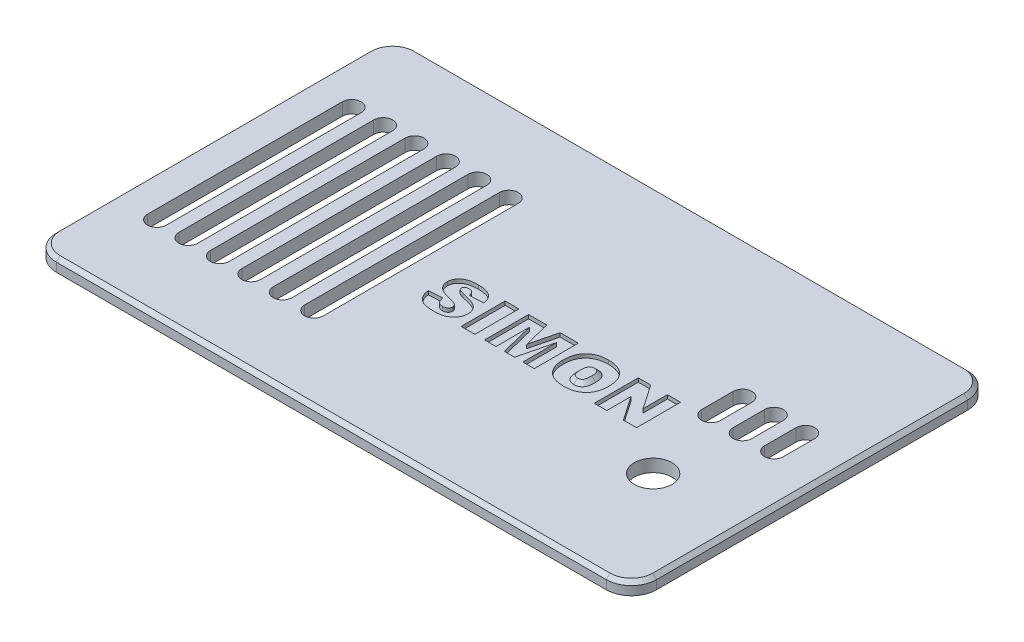
from build123d import *

# Parameters (mm, degrees)
TAPA_DEPTH                        = 2
VENTANA_LDR_Y_VENTILAS_DEPTH      = 56.77297732773462
VENTANA_LDR_Y_VENTILAS_DEPTH_BACK = 56.77297732773462
CROQUIS_VENTANA_Y_VENTILAS_R      = 3.0000000000000027
CROQUIS_TEXTO_W                   = 2.1818181818181825
CROQUIS_TEXTO_H                   = 7.000000000000001
TEXTO_SIMON_DEPTH                 = 0.6
CHAFLAN_CARA_SUPERIOR_SIZE        = 0.6


with BuildPart() as part:
    # Croquis_tapa → Tapa (new body)
    with BuildSketch(Plane(origin=(0, 0, 0), x_dir=(1, 0, 0), z_dir=(0, 1, 0))):
        with BuildLine():
            Line((-43.75000000000001, -28.75), (43.75000000000001, -28.75))
            ThreePointArc((43.75000000000001, -28.75), (46.5784271247462, -27.57842712474619), (47.75, -24.75))
            Line((47.75, -24.75), (47.75, 24.75))
            ThreePointArc((47.75, 24.75), (46.57842712474619, 27.578427124746185), (43.75000000000001, 28.75))
            Line((43.75000000000001, 28.75), (-43.75000000000001, 28.75))
            ThreePointArc((-43.75000000000001, 28.75), (-46.5784271247462, 27.57842712474619), (-47.75, 24.75))
            Line((-47.75, 24.75), (-47.75, -24.75))
            ThreePointArc((-47.75, -24.75), (-46.57842712474619, -27.578427124746185), (-43.75000000000001, -28.75))
        make_face()
    extrude(amount=TAPA_DEPTH)

    # Croquis_ventana_y_ventilas → Ventana_LDR_y_ventilas (cut, two sides: drawn at the far end of the back side and taken through both)
    with BuildSketch(Plane(origin=(0, 0, 0), x_dir=(1, 0, 0), z_dir=(0, 1, 0)).offset(-VENTANA_LDR_Y_VENTILAS_DEPTH_BACK)):
        with Locations(Location((33.46, -11, 0), (0, 0, 270))):
            Circle(CROQUIS_VENTANA_Y_VENTILAS_R)
        with BuildLine():
            Line((-17.5, -15.5), (-17.5, 15.5))
            ThreePointArc((-17.5, 15.5), (-16, 17), (-14.5, 15.5))
            Line((-14.5, 15.5), (-14.5, -15.5))
            ThreePointArc((-14.5, -15.5), (-16, -17), (-17.5, -15.5))
        make_face()
        with BuildLine():
            Line((-22.500000000000004, -15.50000000000001), (-22.500000000000004, 15.49999999999999))
            ThreePointArc((-22.500000000000004, 15.49999999999999), (-21, 16.99999999999999), (-19.5, 15.49999999999999))
            Line((-19.5, 15.49999999999999), (-19.5, -15.50000000000001))
            ThreePointArc((-19.5, -15.50000000000001), (-21, -17.000000000000014), (-22.500000000000004, -15.50000000000001))
        make_face()
        with BuildLine():
            Line((-27.500000000000004, -15.500000000000021), (-27.500000000000004, 15.499999999999979))
            ThreePointArc((-27.500000000000004, 15.499999999999979), (-26.000000000000004, 16.999999999999982), (-24.5, 15.499999999999979))
            Line((-24.5, 15.499999999999979), (-24.5, -15.500000000000021))
            ThreePointArc((-24.5, -15.500000000000021), (-26.000000000000004, -17.00000000000002), (-27.500000000000004, -15.500000000000021))
        make_face()
        with BuildLine():
            Line((-32.5, -15.500000000000032), (-32.5, 15.499999999999968))
            ThreePointArc((-32.5, 15.499999999999968), (-31, 16.999999999999968), (-29.5, 15.499999999999968))
            Line((-29.5, 15.499999999999968), (-29.5, -15.500000000000032))
            ThreePointArc((-29.5, -15.500000000000032), (-31, -17.000000000000032), (-32.5, -15.500000000000032))
        make_face()
        with BuildLine():
            Line((-37.50000000000001, -15.50000000000004), (-37.50000000000001, 15.499999999999957))
            ThreePointArc((-37.50000000000001, 15.499999999999957), (-36.00000000000001, 16.999999999999964), (-34.5, 15.499999999999957))
            Line((-34.5, 15.499999999999957), (-34.5, -15.50000000000004))
            ThreePointArc((-34.5, -15.50000000000004), (-36.00000000000001, -17.000000000000043), (-37.50000000000001, -15.50000000000004))
        make_face()
        with BuildLine():
            Line((-42.5, -15.500000000000052), (-42.5, 15.499999999999948))
            ThreePointArc((-42.5, 15.499999999999948), (-41, 16.99999999999995), (-39.5, 15.499999999999948))
            Line((-39.5, 15.499999999999948), (-39.5, -15.500000000000052))
            ThreePointArc((-39.5, -15.500000000000052), (-41, -17.00000000000005), (-42.5, -15.500000000000052))
        make_face()
        with BuildLine():
            Line((28.499999999999996, 1.68), (28.499999999999996, 6.680000000000001))
            ThreePointArc((28.499999999999996, 6.680000000000001), (30, 8.18), (31.5, 6.680000000000001))
            Line((31.5, 6.680000000000001), (31.5, 1.68))
            ThreePointArc((31.5, 1.68), (30, 0.17999999999999639), (28.499999999999996, 1.68))
        make_face()
        with BuildLine():
            Line((33.5, 1.68), (33.5, 6.680000000000001))
            ThreePointArc((33.5, 6.680000000000001), (35, 8.180000000000007), (36.50000000000001, 6.680000000000001))
            Line((36.50000000000001, 6.680000000000001), (36.50000000000001, 1.68))
            ThreePointArc((36.50000000000001, 1.68), (35, 0.17999999999999994), (33.5, 1.68))
        make_face()
        with BuildLine():
            Line((38.5, 1.68), (38.5, 6.680000000000001))
            ThreePointArc((38.5, 6.680000000000001), (40, 8.18), (41.5, 6.680000000000001))
            Line((41.5, 6.680000000000001), (41.5, 1.68))
            ThreePointArc((41.5, 1.68), (40, 0.17999999999999994), (38.5, 1.68))
        make_face()
    extrude(amount=VENTANA_LDR_Y_VENTILAS_DEPTH + VENTANA_LDR_Y_VENTILAS_DEPTH_BACK, mode=Mode.SUBTRACT)

    # Croquis_texto → Texto_SIMON (cut)
    # profile 1 of 5: a face of its own
    with BuildSketch(Plane(origin=(0, 2, 0), x_dir=(1, 0, 0), z_dir=(0, 1, 0))):
        with BuildLine():
            Line((-9.636363636363637, -3.673295454545454), (-7.454545454545455, -3.5454545454545454))
            add(Edge.make_bspline(
                [(-7.454545454545455, -3.5454545454545454), (-7.443334879168272, -3.623888172631611), (-7.422138415725998, -3.772187029306458), (-7.367963968321025, -3.978497338687695), (-7.299675120562156, -4.156745220271855), (-7.235906679516529, -4.257902176777443), (-7.205965909090909, -4.3053977272727275)],
                knots=[0, 0, 0, 0, 1.1770868639817493, 2.2255841329561408, 3.166870363402418, 3.9999999999999996, 3.9999999999999996, 3.9999999999999996, 3.9999999999999996], degree=3))
            add(Edge.make_bspline(
                [(-7.205965909090909, -4.3053977272727275), (-7.179788136074212, -4.339245246532298), (-7.128590569553015, -4.405443032637478), (-7.038959563551368, -4.491551022292443), (-6.941728468338179, -4.564655482865963), (-6.836351920691705, -4.624657492520284), (-6.7225094161414445, -4.670401084517026), (-6.600897908066968, -4.702899356221522), (-6.470842928730454, -4.723176034233415), (-6.381231068109656, -4.725883039430784), (-6.3352272727272725, -4.7272727272727275)],
                knots=[0, 0, 0, 0, 1.0183953625098916, 1.9917417835245903, 2.950663556748308, 3.9105802343792413, 4.872152798487884, 5.865559653282376, 6.904248206810336, 8, 8, 8, 8], degree=3))
            add(Edge.make_bspline(
                [(-6.3352272727272725, -4.7272727272727275), (-6.268755987561935, -4.724527547837119), (-6.142081216189316, -4.71929604108172), (-5.963166534666255, -4.680680424342079), (-5.809111818670184, -4.6113955866092065), (-5.680697914780001, -4.517120500014326), (-5.582820117951429, -4.402639676289624), (-5.506907512844863, -4.280522336689352), (-5.462733749523046, -4.146860477539383), (-5.4572818673821395, -4.054753254710224), (-5.454545454545454, -4.008522727272727)],
                knots=[0, 0, 0, 0, 1.255494895783263, 2.392604994581436, 3.4334622420041474, 4.424586181737781, 5.3754559945137474, 6.262142743519165, 7.127733362157612, 8, 8, 8, 8], degree=3))
            add(Edge.make_bspline(
                [(-5.454545454545454, -4.008522727272727), (-5.457042638060894, -3.9642188454008944), (-5.461992267179779, -3.876404801124006), (-5.500792405763518, -3.748839170668373), (-5.564055951819271, -3.6286714006327605), (-5.623106642104371, -3.5586562456175215), (-5.653409090909091, -3.5227272727272725)],
                knots=[0, 0, 0, 0, 0.9883148386515781, 1.9589236729170945, 2.9526013902743147, 4, 4, 4, 4], degree=3))
            add(Edge.make_bspline(
                [(-5.653409090909091, -3.5227272727272725), (-5.672796040636891, -3.504573296140464), (-5.715720269131202, -3.464378966963703), (-5.798824742560139, -3.413369120195042), (-5.901181072722431, -3.360762396750202), (-6.025102965381517, -3.310554621350773), (-6.169482323778489, -3.2612092967013973), (-6.334241626646502, -3.2114276061604117), (-6.52070539191982, -3.1637005515103014), (-6.652387590259261, -3.133676403076435), (-6.721590909090909, -3.117897727272727)],
                knots=[0, 0, 0, 0, 0.5512304499143283, 1.2204674854659632, 2.017678125629164, 2.944918582915026, 3.9976076496643045, 5.190855942878632, 6.523702563592668, 7.999999999999999, 7.999999999999999, 7.999999999999999, 7.999999999999999], degree=3))
            add(Edge.make_bspline(
                [(-6.721590909090909, -3.117897727272727), (-6.836435564016809, -3.09146247115067), (-7.058221729738386, -3.040411126192894), (-7.375736164808842, -2.949680781612333), (-7.668394483475909, -2.8560924360017523), (-7.9353165507370385, -2.7534686658991365), (-8.176903725721141, -2.644644561531827), (-8.393182897093535, -2.5300443870251064), (-8.584944625542091, -2.4099229459496834), (-8.697283245167544, -2.319259761792594), (-8.751420454545455, -2.2755681818181817)],
                knots=[0, 0, 0, 0, 1.2752657802061986, 2.462772933144874, 3.57286581951249, 4.5997375036263355, 5.556111329171218, 6.438742692037826, 7.247613028754068, 8, 8, 8, 8], degree=3))
            add(Edge.make_bspline(
                [(-8.751420454545455, -2.2755681818181817), (-8.800207842772847, -2.2310769800005468), (-8.896161431118928, -2.143573003679166), (-9.02139750812741, -1.9977483179322726), (-9.128119336944392, -1.8434502041239278), (-9.21285732894506, -1.6791740161465678), (-9.281027625940188, -1.506655483934994), (-9.328747533654775, -1.3250198895494663), (-9.357907758951438, -1.1339886644771786), (-9.36170068579192, -1.0038929133587353), (-9.363636363636363, -0.9375)],
                knots=[0, 0, 0, 0, 1.0411739214007056, 2.0477499919674957, 3.0259724410385243, 3.995164289565199, 4.958114780489323, 5.947685897473527, 6.952624422992133, 8, 8, 8, 8], degree=3))
            add(Edge.make_bspline(
                [(-9.363636363636363, -0.9375), (-9.359695985294676, -0.8495949654654166), (-9.3518140267966, -0.6737580853760523), (-9.291448831405713, -0.41500705324892695), (-9.192860981080903, -0.16446909573423832), (-9.081046842366272, 0.03536937585750832), (-8.97319111303511, 0.1889129469366951), (-8.880434992723893, 0.2986524729188811), (-8.777352851242092, 0.40122737568511785), (-8.664796719132505, 0.49802563129663674), (-8.542756590358065, 0.5885770992307596), (-8.411293682496703, 0.6734607791582755), (-8.268889740525212, 0.7489398439230583), (-8.117435381397556, 0.8212836060855373), (-7.95334164362542, 0.8853222885745315), (-7.775261745357778, 0.9404060881561882), (-7.582655139782734, 0.9872546186625996), (-7.375804490401286, 1.0249602094546093), (-7.154455825349969, 1.0548550960355996), (-6.918886416499556, 1.0756437401883716), (-6.668707730712644, 1.0886401361356999), (-6.497175747200471, 1.0901392620796508), (-6.409090909090909, 1.0909090909090913)],
                knots=[0, 0, 0, 0, 1.3090717199279431, 2.618542706502086, 3.93669142772237, 5.310779260025486, 6.019465884265697, 6.73046699421611, 7.44892136871403, 8.184394081775846, 8.940790576948082, 9.711951076898002, 10.513842775099734, 11.340797704352406, 12.212135637171828, 13.13605295778236, 14.116643754116284, 15.164270918131468, 16.267925536227978, 17.44397513047766, 18.687434073658263, 20, 20, 20, 20], degree=3))
            add(Edge.make_bspline(
                [(-6.409090909090909, 1.0909090909090913), (-6.301080019374197, 1.0899294320415263), (-6.091867679987706, 1.0880318759337897), (-5.787996362405475, 1.0625112910304502), (-5.503686717643599, 1.0253859653249333), (-5.239014564214066, 0.972136817661253), (-4.994777718848705, 0.9017982358196842), (-4.768877845667273, 0.8194108730549894), (-4.563912609920191, 0.7177374613887577), (-4.376824030582997, 0.6025602840618627), (-4.20898282249446, 0.46907144751620616), (-4.058740130804281, 0.31786617801805633), (-3.92774811279431, 0.14760162871200486), (-3.8143817221546223, -0.04064876416237256), (-3.7199495550460124, -0.2473441562765462), (-3.6415021356573014, -0.4716123671508302), (-3.581375451310744, -0.7141765689827172), (-3.557651385223595, -0.8832484705463705), (-3.5454545454545454, -0.9701704545454545)],
                knots=[0, 0, 0, 0, 1.3115156678148931, 2.5403481234645695, 3.7009575805541344, 4.792716182989153, 5.815693948855718, 6.785616820490555, 7.708932939056227, 8.589794160376693, 9.449314928461911, 10.307353016100883, 11.172377749673979, 12.052130673662482, 12.97072446773444, 13.927412188468951, 14.934456625113587, 16, 16, 16, 16], degree=3))
            Line((-3.5454545454545454, -0.9701704545454545), (-5.727272727272727, -1.0909090909090904))
            add(Edge.make_bspline(
                [(-5.727272727272727, -1.0909090909090904), (-5.741071735226454, -1.0166260944800347), (-5.767049551845123, -0.8767819791936254), (-5.83166791352429, -0.6840544886166381), (-5.919392345109169, -0.5242321159653845), (-6.028951493814268, -0.3955275962083252), (-6.160680945127358, -0.29785826259322973), (-6.314647030399677, -0.22895623209763424), (-6.4909734610531595, -0.18977953933333805), (-6.615331183199284, -0.1845528790667585), (-6.6803977272727275, -0.18181818181818143)],
                knots=[0, 0, 0, 0, 1.2345229490025666, 2.324095390644541, 3.3084612467630055, 4.197778927427227, 5.066467890217188, 5.967370860889678, 6.936486201399829, 7.999999999999999, 7.999999999999999, 7.999999999999999, 7.999999999999999], degree=3))
            add(Edge.make_bspline(
                [(-6.6803977272727275, -0.18181818181818143), (-6.733575955985485, -0.18349207231177422), (-6.833785527776119, -0.18664636785052544), (-6.974617533331878, -0.21610329014979843), (-7.09462398573231, -0.26718958650149705), (-7.193066179924691, -0.337742885425528), (-7.268709490148404, -0.42252617687975474), (-7.325043242758786, -0.5166045255795823), (-7.356554859599625, -0.6211632758004495), (-7.361254029871722, -0.693460953361109), (-7.363636363636364, -0.7301136363636364)],
                knots=[0, 0, 0, 0, 1.2953495816680956, 2.4409693598349427, 3.4852848728728163, 4.452772794322755, 5.368250368663451, 6.2373621078105375, 7.106397188810696, 8, 8, 8, 8], degree=3))
            add(Edge.make_bspline(
                [(-7.363636363636364, -0.7301136363636364), (-7.361767954008994, -0.7574078549645263), (-7.358014496259981, -0.8122393516609977), (-7.325203290960944, -0.8911520894264557), (-7.275285411588779, -0.9664041668339952), (-7.228822839343832, -1.0080624651916774), (-7.204545454545455, -1.0298295454545447)],
                knots=[0, 0, 0, 0, 0.9313593215496262, 1.8710125506619575, 2.887572404170655, 4, 4, 4, 4], degree=3))
            add(Edge.make_bspline(
                [(-7.204545454545455, -1.0298295454545447), (-7.189610486380151, -1.041496335709884), (-7.1572585020302615, -1.0667688245144495), (-7.099372758826626, -1.101115579441741), (-7.027487715433766, -1.1330406178639936), (-6.943105165478338, -1.1653475814897372), (-6.845273239563917, -1.1965454926950436), (-6.734770744085803, -1.2273205662121507), (-6.611338994155007, -1.2589560578729204), (-6.524226133367083, -1.2773286583364538), (-6.478693181818182, -1.2869318181818181)],
                knots=[0, 0, 0, 0, 0.5855837203052892, 1.2684858210062226, 2.0741956093958027, 3.0148962604420184, 4.061191977223796, 5.247631417213221, 6.561366666285349, 8, 8, 8, 8], degree=3))
            add(Edge.make_bspline(
                [(-6.478693181818182, -1.2869318181818181), (-6.364526256776745, -1.31224472088474), (-6.1444039954519845, -1.3610498663473023), (-5.826760073454946, -1.4358018025243373), (-5.535022954526224, -1.5121436462538516), (-5.2684636193855265, -1.5891589814880407), (-5.026409258501662, -1.6649963076471896), (-4.810206064464688, -1.743107815314852), (-4.617986928748538, -1.8190808968224257), (-4.450085450232665, -1.898301179332722), (-4.299070861010282, -1.9790268396699278), (-4.161416279669968, -2.064522383815481), (-4.033381618457984, -2.153544589975777), (-3.9159056507473378, -2.24774584512524), (-3.8095188004297333, -2.347393544344418), (-3.712478310377793, -2.4507673952595863), (-3.626497299891709, -2.559614982933532), (-3.5271392891491953, -2.7101729504683245), (-3.4251386011442784, -2.909072757506448), (-3.335763095013531, -3.1619935962959356), (-3.2818887337364093, -3.4295383847610603), (-3.2758111503039555, -3.612916487933229), (-3.2727272727272725, -3.705965909090909)],
                knots=[0, 0, 0, 0, 1.59216922401928, 3.069819826325439, 4.442701820227377, 5.697484839518971, 6.847378755218487, 7.895511839985007, 8.826870635109142, 9.660312258422223, 10.421783000006778, 11.157070095266254, 11.865294080332674, 12.543880036336077, 13.205252393812037, 13.848401971930857, 14.472630749782457, 15.091275345676452, 16.302236042830973, 17.505191011927693, 18.734088049644864, 19.999999999999996, 19.999999999999996, 19.999999999999996, 19.999999999999996], degree=3))
            add(Edge.make_bspline(
                [(-3.2727272727272725, -3.705965909090909), (-3.273823563509547, -3.7614031692057592), (-3.2759933094944684, -3.8711229392650357), (-3.2932135665392726, -4.034111068369788), (-3.323413443532376, -4.193514213047641), (-3.3646848030738306, -4.350167413578228), (-3.4170859350873144, -4.503632918508403), (-3.481626447840394, -4.6534537848830535), (-3.5569873449134985, -4.800441688924507), (-3.6444772500641305, -4.942842248475109), (-3.7429962115705666, -5.0789309437093735), (-3.8486005981271223, -5.209085443826205), (-3.9667298515129525, -5.32790741879485), (-4.090967691114805, -5.441889610891039), (-4.228604171109557, -5.542329669157089), (-4.371622391080177, -5.639356688204205), (-4.526603019691938, -5.723679380514798), (-4.689480252409125, -5.802712342287931), (-4.863710498878686, -5.870160329611856), (-5.047398428395101, -5.9306013021723345), (-5.2427081180207304, -5.979482603243517), (-5.448783375932715, -6.021128542238441), (-5.66611448573437, -6.051563192428639), (-5.894036898303722, -6.074157244823161), (-6.13238031986896, -6.088956318622567), (-6.294958656648562, -6.0902497175810675), (-6.377840909090909, -6.090909090909092)],
                knots=[0, 0, 0, 0, 0.9060699158918729, 1.79326652549799, 2.6752149076033094, 3.5556677695632706, 4.439244741281412, 5.323397785795382, 6.219930382744195, 7.137170545372751, 8.052187567754274, 8.964877591415792, 9.873423338271003, 10.788702186832113, 11.71746204584966, 12.6555273837023, 13.611744183526287, 14.598361817812151, 15.613055282879133, 16.663057223607126, 17.757447018868227, 18.90192347463983, 20.098271487158687, 21.342794295827503, 22.64535953358268, 24, 24, 24, 24], degree=3))
            add(Edge.make_bspline(
                [(-6.377840909090909, -6.090909090909092), (-6.5213545203480905, -6.0885976045232795), (-6.797378342629765, -6.084151856821897), (-7.19424121978707, -6.054145065595998), (-7.556211799861083, -5.999936997120818), (-7.884872342095792, -5.928185777465733), (-8.178706412902613, -5.831290254628128), (-8.440230867695023, -5.7159124541592385), (-8.666861098472895, -5.576827291549666), (-8.858406681825132, -5.414220894247351), (-9.022295270265092, -5.236213412799885), (-9.165396589743775, -5.046121320321677), (-9.293762203809564, -4.846956843329333), (-9.399829541644749, -4.6340310452204845), (-9.488215696938042, -4.410181097318496), (-9.558093145435993, -4.175030920453881), (-9.607791637519393, -3.9281345153162515), (-9.6267349617346, -3.7591754243826427), (-9.636363636363637, -3.673295454545454)],
                knots=[0, 0, 0, 0, 1.5058034673226501, 2.896154762007625, 4.172048974132561, 5.343508696749554, 6.421214707972998, 7.412908531146506, 8.336567114734306, 9.200370627603807, 10.04053633819003, 10.870193374875488, 11.694343727936253, 12.523048298742156, 13.361626237615692, 14.216714319043014, 15.093576322851693, 16, 16, 16, 16], degree=3))
        make_face()
    # profile 2 of 5: a face of its own
    with BuildSketch(Plane(origin=(0, 2, 0), x_dir=(1, 0, 0), z_dir=(0, 1, 0))):
        with Locations((-1, -2.4999999999999996)):
            Rectangle(CROQUIS_TEXTO_W, CROQUIS_TEXTO_H)
    # profile 3 of 5: a face of its own
    with BuildSketch(Plane(origin=(0, 2, 0), x_dir=(1, 0, 0), z_dir=(0, 1, 0))):
        Polygon((1.6363636363636371, 1.0000000000000009), (4.544034090909092, 1.0000000000000009), (5.595170454545455, -3.2485795454545454), (6.644886363636365, 1.0000000000000009), (9.545454545454547, 1.0000000000000009), (9.545454545454547, -6), (7.72727272727273, -6), (7.72727272727273, -0.6406249999999997), (6.401988636363638, -6), (4.779829545454547, -6), (3.454545454545455, -0.6406249999999997), (3.454545454545455, -6), (1.6363636363636371, -6), align=None)
    # profile 4 of 5: a face of its own
    with BuildSketch(Plane(origin=(0, 2, 0), x_dir=(1, 0, 0), z_dir=(0, 1, 0))):
        with BuildLine():
            add(Edge.make_bspline(
                [(10.636363636363637, -2.5042613636363633), (10.639460607674883, -2.366363347806043), (10.645490137062664, -2.0978881004097545), (10.689483689591832, -1.7065861237074569), (10.764507539053978, -1.3385597077826314), (10.869331838336498, -0.9940629588044527), (11.003022105848475, -0.6724582050532968), (11.168962529672356, -0.37547789329591535), (11.364228574928719, -0.10111166501430156), (11.589258992071198, 0.14817186482587602), (11.841646631584785, 0.36961490985809436), (12.116776208515573, 0.5648893956602735), (12.418054463123509, 0.7267920627420155), (12.741608381188827, 0.8606497965770371), (13.088656391061768, 0.9643343946485303), (13.458743187917165, 1.036982700679966), (13.852002136119056, 1.0841464931943483), (14.122490535072313, 1.088614925686248), (14.26136363636364, 1.0909090909090913)],
                knots=[0, 0, 0, 0, 1.141509497606743, 2.2224180886857847, 3.2548744861864254, 4.246852721239051, 5.199093221333552, 6.132658289147604, 7.057234514417991, 7.981445044859864, 8.906287139182032, 9.831793571989309, 10.768447855708017, 11.731542758355008, 12.726135354727411, 13.761653046554935, 14.850796616809317, 16, 16, 16, 16], degree=3))
            add(Edge.make_bspline(
                [(14.26136363636364, 1.0909090909090913), (14.403061917326605, 1.0884733282423402), (14.679131991178787, 1.0837277436471953), (15.080453619977945, 1.0385344889869785), (15.457659581185377, 0.9673301335348446), (15.809290727018983, 0.8652751869859759), (16.13623407067102, 0.7343260404981528), (16.437292034466815, 0.5733027333004833), (16.714081914235898, 0.3831891216848262), (16.964076428067273, 0.16369766635784877), (17.1879990267127, -0.08048832606656481), (17.381052065033845, -0.35047226388781977), (17.544991809362166, -0.6429069936758375), (17.679014841198917, -0.9592263889369261), (17.782524663594273, -1.2987944146694437), (17.85505601000403, -1.6613621405725398), (17.902362496245765, -2.0465734158257787), (17.90680759599719, -2.3114064660827043), (17.90909090909091, -2.4474431818181817)],
                knots=[0, 0, 0, 0, 1.1762858115034174, 2.291751943962522, 3.3489565652634177, 4.3605475423483675, 5.3272434560292785, 6.268348986953007, 7.189933859112019, 8.109453091483415, 9.025105683474758, 9.935135630691034, 10.859333697713936, 11.80361251231324, 12.782426517391587, 13.80183482549847, 14.870869135505602, 16, 16, 16, 16], degree=3))
            add(Edge.make_bspline(
                [(17.90909090909091, -2.4474431818181817), (17.90750582467957, -2.5464239436281955), (17.904401146953468, -2.74029586887463), (17.88663272632455, -3.024402484134306), (17.853649838770703, -3.295078874279767), (17.808736242495783, -3.5522354848834907), (17.750556264369777, -3.795643145148656), (17.679929415363127, -4.025730187513329), (17.594287918052245, -4.241277328182131), (17.497946865938594, -4.444505449136456), (17.387270367096402, -4.634042597708653), (17.266967574920354, -4.813481433664436), (17.13399431623169, -4.981623626375643), (16.990580411641044, -5.1395895628139385), (16.835279894246106, -5.286907123759671), (16.66685787646283, -5.421012009190142), (16.488992931699123, -5.547326181501544), (16.29848348571726, -5.66070005028227), (16.096194671178893, -5.761709039800897), (15.882118871997687, -5.850000983133106), (15.655858080423732, -5.925473582845329), (15.417002238215767, -5.986243434042447), (15.166344675768938, -6.032535096169966), (14.904202055428803, -6.066928634526702), (14.629564956182989, -6.086627374759854), (14.44226579882331, -6.089461422033965), (14.346590909090912, -6.090909090909092)],
                knots=[0, 0, 0, 0, 1.2271705805450368, 2.4036380272836126, 3.5270704034307947, 4.606008097853839, 5.638218407414541, 6.627805636178698, 7.587035219341011, 8.511212202784343, 9.413314863261817, 10.30548933947667, 11.187409042471497, 12.068331905466174, 12.948628723884662, 13.83786319036211, 14.735197903834312, 15.651286310776959, 16.5832044291849, 17.535946325181566, 18.51975415377185, 19.537695563225785, 20.588810061930523, 21.678029866754635, 22.81390690918291, 24, 24, 24, 24], degree=3))
            add(Edge.make_bspline(
                [(14.346590909090912, -6.090909090909092), (14.24997883134268, -6.089813708918799), (14.060387448217883, -6.087664133095261), (13.78252485437034, -6.070971072887096), (13.5171439444792, -6.040769934881189), (13.264787333995715, -6.000260824874056), (13.024869955011711, -5.947409856379935), (12.797909464025885, -5.884137368926421), (12.58323569188004, -5.808619172373447), (12.380863573704644, -5.720540853287922), (12.189696386396005, -5.619071852917194), (12.008267736143106, -5.505365187547292), (11.837155770828748, -5.376616131560404), (11.675208983312137, -5.234193701039648), (11.521580662087942, -5.078876956425473), (11.375988264882746, -4.911062038317805), (11.240935928879155, -4.728547319296154), (11.116261284325251, -4.5324638451011925), (11.001881590265603, -4.3240513289122084), (10.90391336882576, -4.101535981164713), (10.82159514936454, -3.8657865003768133), (10.753729485396445, -3.6180416911726607), (10.701251587909764, -3.357424230820082), (10.663071602537263, -3.084737566459973), (10.639940043643703, -2.7986988796590264), (10.637571923505805, -2.6037369090433526), (10.636363636363637, -2.5042613636363633)],
                knots=[0, 0, 0, 0, 1.1823544088062532, 2.320250355172457, 3.404920019835303, 4.449983545126182, 5.446830610656614, 6.4099612102321695, 7.331835133876033, 8.229702173152354, 9.108460858144069, 9.978232002170998, 10.847443168270106, 11.726182747112357, 12.6153498471981, 13.519180864622887, 14.442874230163987, 15.391301827997088, 16.361103301107498, 17.349561128181648, 18.36304461618704, 19.414578589861595, 20.49079478194908, 21.61433217254373, 22.782759491265413, 24, 24, 24, 24], degree=3))
        make_face()
        with BuildLine():
            add(Edge.make_bspline(
                [(12.81818181818182, -2.5042613636363633), (12.819088361891486, -2.588103722656582), (12.820837286726574, -2.749854317094827), (12.839318006095624, -2.9832940299309896), (12.870237235375855, -3.198260439052658), (12.9126648293332, -3.394832871008434), (12.965283662687302, -3.574042691470484), (13.034500786378908, -3.733853304240795), (13.112905495627844, -3.876836832330338), (13.205390465457183, -4.000938922695785), (13.308516528727518, -4.107584089204449), (13.419944917241448, -4.201234660111424), (13.541403745765013, -4.279414678920003), (13.671484310201715, -4.343752521180435), (13.810198143638235, -4.393630253050092), (13.957369709001867, -4.42890550573349), (14.11345326072065, -4.450780814011365), (14.220569805638915, -4.4532682795952905), (14.275568181818183, -4.454545454545454)],
                knots=[0, 0, 0, 0, 1.450299893483712, 2.7979516872628087, 4.047956828123061, 5.2048141795994605, 6.275045649585114, 7.273222876655889, 8.21209241345935, 9.090248036666704, 9.941908401880353, 10.773637600004323, 11.602983325627614, 12.434591495080006, 13.279329446247988, 14.147571640880427, 15.048881273964389, 16, 16, 16, 16], degree=3))
            add(Edge.make_bspline(
                [(14.275568181818183, -4.454545454545454), (14.331514365754407, -4.453266133216183), (14.440988100845477, -4.450762797430912), (14.599761970237948, -4.428832038565029), (14.749361884456977, -4.395093957802201), (14.889127701423057, -4.346855825472571), (15.019357944161415, -4.284051302727069), (15.139679309660961, -4.206891528115838), (15.249218939057783, -4.115138620948412), (15.35076023832156, -4.010135782900948), (15.44181647455346, -3.8864146059538474), (15.517884550343323, -3.739292202331401), (15.582560676745894, -3.570935221806591), (15.636421849646503, -3.381293867959779), (15.676742360807989, -3.169692477912136), (15.705903301303756, -2.9362679028564984), (15.724731138112972, -2.680704863934736), (15.726403893018142, -2.5028761612766735), (15.727272727272728, -2.4105113636363633)],
                knots=[0, 0, 0, 0, 0.9343700973985084, 1.8283460519171058, 2.6727444141538212, 3.4933860167050708, 4.293052863066398, 5.0830736691346665, 5.8751911265812975, 6.6753274447128295, 7.518724565703245, 8.431784963600467, 9.433743099565602, 10.528049476186178, 11.721186616425879, 13.029232024476077, 14.456973599907565, 16, 16, 16, 16], degree=3))
            add(Edge.make_bspline(
                [(15.727272727272728, -2.4105113636363633), (15.72636371279273, -2.332346874784881), (15.724603517351474, -2.1809908953453654), (15.705991524574092, -1.9622274450124253), (15.675533960637633, -1.7598237667973853), (15.631191388003243, -1.5742296846352155), (15.576415038320942, -1.4040767410571053), (15.508582316470532, -1.2498550895163132), (15.427398408185867, -1.1125459933060213), (15.333962385647967, -0.9916883384397529), (15.229835874658216, -0.8865442839993117), (15.117038244599009, -0.7949587688710752), (14.995283485531646, -0.7171045744257754), (14.863924255062607, -0.6556200497550464), (14.725190139114881, -0.6041218731928455), (14.575992967938438, -0.5715228313863557), (14.418760786536195, -0.5492234066743343), (14.310688750693974, -0.5467257915070349), (14.255681818181822, -0.5454545454545452)],
                knots=[0, 0, 0, 0, 1.3866120099114299, 2.6850046862266272, 3.8922135905330166, 5.014997860429714, 6.06706670327333, 7.059978218722937, 7.9979495742341085, 8.890262602465024, 9.763547239312105, 10.617710116248038, 11.463736341746182, 12.320498160296887, 13.186844933843807, 14.08353719678589, 15.024551177768558, 16, 16, 16, 16], degree=3))
            add(Edge.make_bspline(
                [(14.255681818181822, -0.5454545454545452), (14.20304767220597, -0.5467552957719785), (14.099700946844388, -0.5493093086343025), (13.948387435374334, -0.5713021503524152), (13.804835564034827, -0.6060721855351127), (13.669639690360057, -0.6565828130033105), (13.542458125664101, -0.7208994803145831), (13.422589447079863, -0.7991752076176198), (13.31131851178408, -0.8923628644162955), (13.207816393327363, -0.999594547465924), (13.115079019283733, -1.1237472431377153), (13.035071887098512, -1.2666896018241633), (12.967223517771513, -1.4277381884177334), (12.912149931738787, -1.6077111908765491), (12.870411424675407, -1.8060645497442929), (12.839273724591369, -2.0223774841222317), (12.820853081834835, -2.2572544035236817), (12.819093635422893, -2.419947258347115), (12.81818181818182, -2.5042613636363633)],
                knots=[0, 0, 0, 0, 0.9142685359277805, 1.7951589702360755, 2.6512986956873834, 3.476635500231191, 4.297241834827498, 5.123398564871082, 5.958845571891921, 6.814312837825198, 7.707908803529882, 8.64380444936425, 9.654011713921754, 10.73930675696677, 11.909377047630842, 13.173112581612301, 14.534991080625744, 16, 16, 16, 16], degree=3))
        make_face(mode=Mode.SUBTRACT)
    # profile 5 of 5: a face of its own
    with BuildSketch(Plane(origin=(0, 2, 0), x_dir=(1, 0, 0), z_dir=(0, 1, 0))):
        Polygon((19.090909090909097, 1.0000000000000009), (21.07670454545455, 1.0000000000000009), (23.72727272727273, -2.8721590909090904), (23.72727272727273, 1.0000000000000009), (25.818181818181817, 1.0000000000000009), (25.818181818181817, -6), (23.72727272727273, -6), (21.09090909090909, -2.149147727272727), (21.09090909090909, -6), (19.090909090909097, -6), align=None)
    extrude(amount=-TEXTO_SIMON_DEPTH, mode=Mode.SUBTRACT)

    # Chaflan_cara_superior
    chaflan_cara_superior_edges = [part.edges().sort_by_distance(p)[0] for p in [
        (0, 2, 28.75),
        (-46.57842712474619, 2, 27.578427124746185),
        (46.5784271247462, 2, 27.57842712474619),
        (-47.75, 2, 0),
        (47.75, 2, 0),
        (-46.5784271247462, 2, -27.57842712474619),
        (46.57842712474619, 2, -27.578427124746185),
        (0, 2, -28.75),
    ]]
    chamfer(chaflan_cara_superior_edges, length=CHAFLAN_CARA_SUPERIOR_SIZE)
    chaflan_cara_superior_2_edges = [part.edges().sort_by_distance(p)[0] for p in [
        (13.098432499853985, 2, 3.8466271261743596),
    ]]
    chamfer(chaflan_cara_superior_2_edges, length=CHAFLAN_CARA_SUPERIOR_SIZE - 0.0004)  # a hair under: the kernel refuses the full size


solid = part.part
